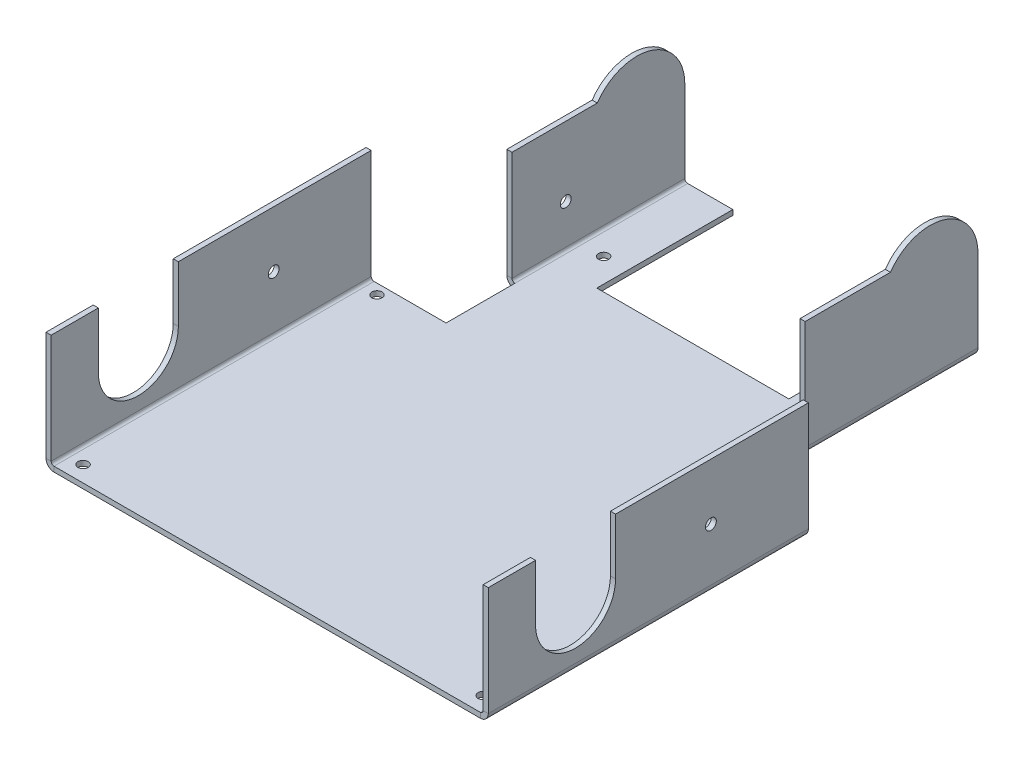
from build123d import *

# Parameters (mm, degrees)
BOSS_EXTRUDE2_DEPTH            = 1.6
EDGE_FLANGE1_STRIP_W           = 8.198
EDGE_FLANGE1_STRIP_H           = 1.6
EDGE_FLANGE1_STRIP_CUT_DEPTH   = 100
EDGE_FLANGE1_STRIP_2_W         = 8.198
EDGE_FLANGE1_STRIP_2_H         = 1.6
EDGE_FLANGE1_STRIP_CUT_2_DEPTH = 75.5
EDGE_FLANGE1_STRIP_3_W         = 8.198
EDGE_FLANGE1_STRIP_3_H         = 1.6
EDGE_FLANGE1_STRIP_CUT_3_DEPTH = 75.5
EDGE_FLANGE1_STRIP_4_W         = 8.198
EDGE_FLANGE1_STRIP_4_H         = 1.6
EDGE_FLANGE1_STRIP_CUT_4_DEPTH = 100
EDGE_FLANGE1_DEPTH             = 100
EDGE_FLANGE1_BEND_DEPTH        = 75.5
EDGE_FLANGE1_BEND_2_DEPTH      = 75.5
EDGE_FLANGE1_BEND_3_DEPTH      = 100
CUT_EXTRUDE1_START             = -69.018571159
CUT_EXTRUDE1_DEPTH             = 21.5
SKETCH24_R                     = 15
BOSS_EXTRUDE3_DEPTH            = 1.6
BOSS_EXTRUDE4_START            = -1.6
SKETCH25_R                     = 15
BOSS_EXTRUDE4_DEPTH            = 1.6
CUT_EXTRUDE2_DEPTH             = 109.6
CUT_EXTRUDE3_DEPTH             = 1000
M3_CLEARANCE_HOLE1_D           = 3.2
HOLE1_D                        = 3.4
HOLE1_DEPTH                    = 67.5
HOLE1_CBORE_D                  = 6
HOLE1_CBORE_DEPTH              = 16
CUT_EXTRUDE4_REACH             = 180.195
SKETCH36_R                     = 1.7


# Read off the part's stored shape, not the designer's step: Cut-Extrude1
# Sheet-metal steps are written as plain solids
with BuildPart() as part:
    # Sketch1 → Boss-Extrude2 (new body)
    with BuildSketch(Plane(origin=(0, 0, 0), x_dir=(1, 0, 0), z_dir=(0, 1, 0))):
        Polygon((45, 47.518571159), (45, 123.018571159), (30, 123.018571159), (30, 80.518571159), (-30, 80.518571159), (-30, 123.018571159), (-45, 123.018571159), (-45, 47.518571159), (-67.5, 47.518571159), (-67.5, -52.481428841), (67.5, -52.481428841), (67.5, 47.518571159), align=None)
    extrude(amount=BOSS_EXTRUDE2_DEPTH)

    # Edge-Flange1 strip (across the edge) → Edge-Flange1 strip cut (cut)
    with BuildSketch(Plane(origin=(-67.5, 1.6, -47.518571159), x_dir=(1, 0, 0), z_dir=(0, 0, 1))):
        with Locations((-3.2, -0.8)):
            Rectangle(EDGE_FLANGE1_STRIP_W, EDGE_FLANGE1_STRIP_H)
    extrude(amount=EDGE_FLANGE1_STRIP_CUT_DEPTH, mode=Mode.SUBTRACT)

    # Edge-Flange1 strip 2 (across the edge) → Edge-Flange1 strip cut 2 (cut)
    with BuildSketch(Plane(origin=(-45, 1.6, -123.018571159), x_dir=(1, 0, 0), z_dir=(0, 0, 1))):
        with Locations((-3.2, -0.8)):
            Rectangle(EDGE_FLANGE1_STRIP_2_W, EDGE_FLANGE1_STRIP_2_H)
    extrude(amount=EDGE_FLANGE1_STRIP_CUT_2_DEPTH, mode=Mode.SUBTRACT)

    # Edge-Flange1 strip 3 (across the edge) → Edge-Flange1 strip cut 3 (cut)
    with BuildSketch(Plane(origin=(45, 1.6, -47.518571159), x_dir=(-1, 0, 0), z_dir=(0, 0, -1))):
        with Locations((-3.2, -0.8)):
            Rectangle(EDGE_FLANGE1_STRIP_3_W, EDGE_FLANGE1_STRIP_3_H)
    extrude(amount=EDGE_FLANGE1_STRIP_CUT_3_DEPTH, mode=Mode.SUBTRACT)

    # Edge-Flange1 strip 4 (across the edge) → Edge-Flange1 strip cut 4 (cut)
    with BuildSketch(Plane(origin=(67.5, 1.6, 52.481428841), x_dir=(-1, 0, 0), z_dir=(0, 0, -1))):
        with Locations((-3.2, -0.8)):
            Rectangle(EDGE_FLANGE1_STRIP_4_W, EDGE_FLANGE1_STRIP_4_H)
    extrude(amount=EDGE_FLANGE1_STRIP_CUT_4_DEPTH, mode=Mode.SUBTRACT)

    # Edge-Flange1 section (across the edge) → Edge-Flange1 (add)
    with BuildSketch(Plane(origin=(-67.5, 1.6, -47.518571159), x_dir=(1, 0, 0), z_dir=(0, 0, 1))):
        with BuildLine():
            Line((-1.6, 0.899), (-1.6, 35))
            Line((-1.6, 35), (0, 35))
            Line((0, 35), (0, 0.899))
            ThreePointArc((0, 0.899), (0.263311004, 0.263311004), (0.899, 0))
            Line((0.899, 0), (0.899, -1.6))
            ThreePointArc((0.899, -1.6), (-0.868059846, -0.868059846), (-1.6, 0.899))
        make_face()
    extrude(amount=EDGE_FLANGE1_DEPTH)

    # Edge-Flange1 section 2 (across the edge) → Edge-Flange1 bend (add)
    with BuildSketch(Plane(origin=(-45, 1.6, -123.018571159), x_dir=(1, 0, 0), z_dir=(0, 0, 1))):
        with BuildLine():
            Line((-1.6, 0.899), (-1.6, 35))
            Line((-1.6, 35), (0, 35))
            Line((0, 35), (0, 0.899))
            ThreePointArc((0, 0.899), (0.263311004, 0.263311004), (0.899, 0))
            Line((0.899, 0), (0.899, -1.6))
            ThreePointArc((0.899, -1.6), (-0.868059846, -0.868059846), (-1.6, 0.899))
        make_face()
    extrude(amount=EDGE_FLANGE1_BEND_DEPTH)

    # Edge-Flange1 section 3 (across the edge) → Edge-Flange1 bend 2 (add)
    with BuildSketch(Plane(origin=(45, 1.6, -47.518571159), x_dir=(-1, 0, 0), z_dir=(0, 0, -1))):
        with BuildLine():
            Line((-1.6, 0.899), (-1.6, 35))
            Line((-1.6, 35), (0, 35))
            Line((0, 35), (0, 0.899))
            ThreePointArc((0, 0.899), (0.263311004, 0.263311004), (0.899, 0))
            Line((0.899, 0), (0.899, -1.6))
            ThreePointArc((0.899, -1.6), (-0.868059846, -0.868059846), (-1.6, 0.899))
        make_face()
    extrude(amount=EDGE_FLANGE1_BEND_2_DEPTH)

    # Edge-Flange1 section 4 (across the edge) → Edge-Flange1 bend 3 (add)
    with BuildSketch(Plane(origin=(67.5, 1.6, 52.481428841), x_dir=(-1, 0, 0), z_dir=(0, 0, -1))):
        with BuildLine():
            Line((-1.6, 0.899), (-1.6, 35))
            Line((-1.6, 35), (0, 35))
            Line((0, 35), (0, 0.899))
            ThreePointArc((0, 0.899), (0.263311004, 0.263311004), (0.899, 0))
            Line((0.899, 0), (0.899, -1.6))
            ThreePointArc((0.899, -1.6), (-0.868059846, -0.868059846), (-1.6, 0.899))
        make_face()
    extrude(amount=EDGE_FLANGE1_BEND_3_DEPTH)

    # Cut-Extrude1 outline → Cut-Extrude1 (cut)
    with BuildSketch(Plane.XY.offset(CUT_EXTRUDE1_START)):
        with BuildLine():
            ThreePointArc((45, 2.499), (44.736688996, 1.863311004), (44.101, 1.6))
            Line((44.101, 1.6), (44.101, 0))
            ThreePointArc((44.101, 0), (45.868059846, 0.731940154), (46.6, 2.499))
            Line((46.6, 2.499), (46.6, 36.6))
            Line((46.6, 36.6), (45, 36.6))
            Line((45, 36.6), (45, 2.499))
        make_face()
        with BuildLine():
            ThreePointArc((-46.6, 2.499), (-45.868059846, 0.731940154), (-44.101, 0))
            Line((-44.101, 0), (-44.101, 1.6))
            ThreePointArc((-44.101, 1.6), (-44.736688996, 1.863311004), (-45, 2.499))
            Line((-45, 2.499), (-45, 36.6))
            Line((-45, 36.6), (-46.6, 36.6))
            Line((-46.6, 36.6), (-46.6, 2.499))
        make_face()
    extrude(amount=CUT_EXTRUDE1_DEPTH, mode=Mode.SUBTRACT)

    # Sketch24 → Boss-Extrude3 (add)
    with BuildSketch(Plane(origin=(46.6, 0, 0), x_dir=(0, 0, -1), z_dir=(1, 0, 0))):
        with Locations((108.018571159, 28.1)):
            Circle(SKETCH24_R)
    extrude(amount=-BOSS_EXTRUDE3_DEPTH)

    # Sketch25 → Boss-Extrude4 (add)
    with BuildSketch(Plane.ZY.offset(46.6).offset(BOSS_EXTRUDE4_START)):
        with Locations((-108.018571159, 28.1)):
            Circle(SKETCH25_R)
    extrude(amount=BOSS_EXTRUDE4_DEPTH)

    # Sketch26 → Cut-Extrude2 (cut)
    with BuildSketch(Plane(origin=(46.6, 0, 0), x_dir=(0, 0, -1), z_dir=(1, 0, 0))):
        with BuildLine():
            Line((120.377778253, 36.6), (123.018571159, 36.6))
            Line((123.018571159, 36.6), (123.018571159, 28.1))
            ThreePointArc((123.018571159, 28.1), (122.343167251, 32.550387263), (120.377778253, 36.6))
        make_face()
    extrude(amount=-CUT_EXTRUDE2_DEPTH, mode=Mode.SUBTRACT)

    # Sketch27 → Cut-Extrude3 (cut)
    with BuildSketch(Plane(origin=(69.1, 0, 0), x_dir=(0, 0, -1), z_dir=(1, 0, 0))):
        with BuildLine():
            Line((-37.729365474, 19.100000095), (-37.729365474, 36.6))
            Line((-37.729365474, 36.6), (-12.729365474, 36.6))
            Line((-12.729365474, 36.6), (-12.729365474, 19.100000095))
            ThreePointArc((-12.729365474, 19.100000095), (-25.229365474, 6.600000095), (-37.729365474, 19.100000095))
        make_face()
    extrude(amount=-CUT_EXTRUDE3_DEPTH, mode=Mode.SUBTRACT)

    # M3 Clearance Hole1 (through all)
    with Locations(Plane(origin=(0, 1.6, -32.518571159), x_dir=(-1, 0, 0), z_dir=(0, 1, 0))):
        with Locations((-62.5, -11.814648696), (62.5, -11.814648696), (62.5, 80), (-62.5, 80), (-37.5, -57.632792906), (37.5, -57.632792906)):
            Hole(M3_CLEARANCE_HOLE1_D / 2)

    # Hole1
    with Locations(Plane(origin=(120, 6.6, -32.518571159), x_dir=(0, 0, 1), z_dir=(1, 0, 0))):
        with Locations((15.451100734, -12.39688985)):
            hole1 = CounterBoreHole(HOLE1_D / 2, HOLE1_CBORE_D / 2, HOLE1_CBORE_DEPTH, depth=HOLE1_DEPTH)

    # Mirror1: Hole1 across Right Plane
    add(hole1.mirror(Plane(origin=(0, 0, 0), x_dir=(0, 0, -1), z_dir=(1, 0, 0))), mode=Mode.SUBTRACT)

    # Sketch36 → Cut-Extrude4 (cut, up to next)
    with BuildSketch(Plane(origin=(-80, 6.6, -32.518571159), x_dir=(0, 0, 1), z_dir=(-1, 0, 0)), mode=Mode.PRIVATE) as cut_extrude4_sk1:
        with Locations(Location((-53.294944095, 8.283400622, 0), (0, 0, 90))):
            Circle(SKETCH36_R)
    cut_extrude4_tool1 = extrude(cut_extrude4_sk1.sketch, amount=-CUT_EXTRUDE4_REACH, mode=Mode.PRIVATE) & part.part
    add(cut_extrude4_tool1.solids().sort_by_distance((-80, 14.883401, -85.813515))[0], mode=Mode.SUBTRACT)


solid = part.part
